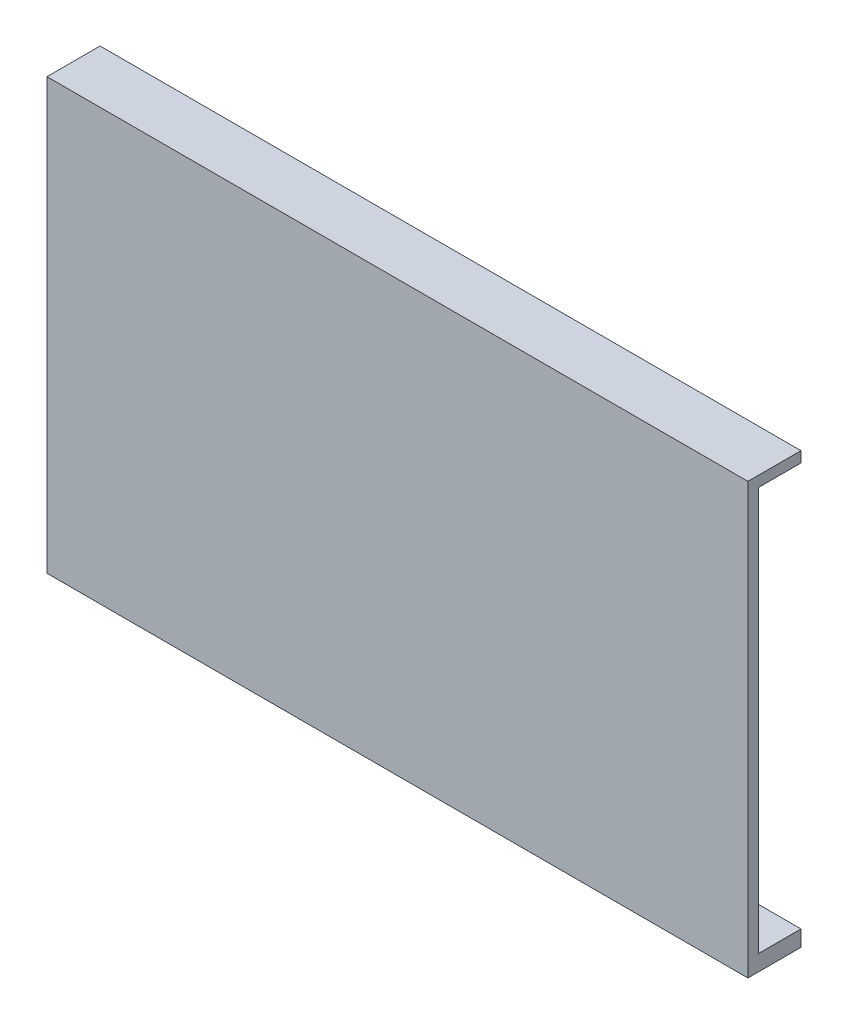
from build123d import *

# Parameters (mm, degrees)
CROQUIS1_W              = 132
CROQUIS1_H              = 81
SALIENTE_EXTRUIR1_DEPTH = 10
CROQUIS2_W              = 132
CROQUIS2_H              = 76
CORTAR_EXTRUIR1_DEPTH   = 8


with BuildPart() as part:
    # Croquis1 → Saliente-Extruir1 (new body)
    with BuildSketch(Plane.XY):
        with Locations((0, 40.5)):
            Rectangle(CROQUIS1_W, CROQUIS1_H)
    extrude(amount=SALIENTE_EXTRUIR1_DEPTH)

    # Croquis2 → Cortar-Extruir1 (cut)
    with BuildSketch(Plane(origin=(0, 0, 0), x_dir=(-1, 0, 0), z_dir=(0, 0, -1))):
        with Locations((0, 41)):
            Rectangle(CROQUIS2_W, CROQUIS2_H)
    extrude(amount=-CORTAR_EXTRUIR1_DEPTH, mode=Mode.SUBTRACT)


solid = part.part
